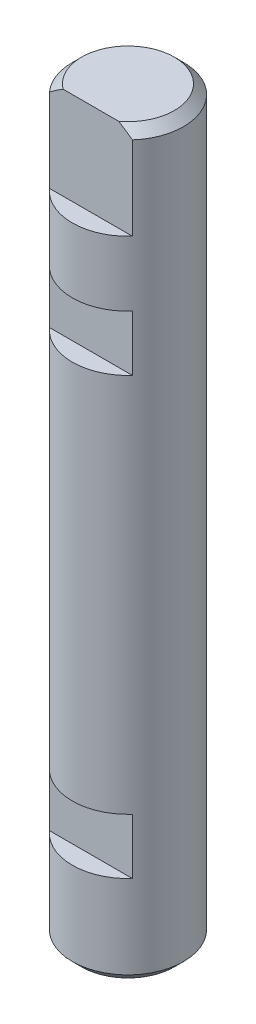
from build123d import *

# Parameters (mm, degrees)
CROQUIS1_R                 = 3
SALIENTE_EXTRUIR1_DEPTH    = 20
CORTAR_EXTRUIR2_DEPTH      = 41.224370722
CORTAR_EXTRUIR2_DEPTH_BACK = 5
CROQUIS3_W                 = 8.224241852
CROQUIS3_H                 = 1
CROQUIS8_W                 = 6
CROQUIS8_H                 = 3
CORTAR_EXTRUIR4_DEPTH      = 10
CHAFL_N1_SIZE              = 0.5


with BuildPart() as part:
    # Croquis1 → Saliente-Extruir1 (new, symmetric)
    with BuildSketch(Plane(origin=(0, 0, 0), x_dir=(1, 0, 0), z_dir=(0, 1, 0))):
        Circle(CROQUIS1_R)
    extrude(amount=SALIENTE_EXTRUIR1_DEPTH, both=True)

    # Croquis3 → Cortar-Extruir2 (cut, two sides: drawn at the far end of the back side and taken through both)
    with BuildSketch(Plane(origin=(0, 20, 0), x_dir=(1, 0, 0), z_dir=(0, 1, 0)).offset(-CORTAR_EXTRUIR2_DEPTH_BACK)):
        with Locations((0.237694851, -2.5)):
            Rectangle(CROQUIS3_W, CROQUIS3_H)
    extrude(amount=CORTAR_EXTRUIR2_DEPTH + CORTAR_EXTRUIR2_DEPTH_BACK, mode=Mode.SUBTRACT)

    # Croquis8 → Cortar-Extruir4 (cut)
    with BuildSketch(Plane.XY.offset(2)):
        with Locations((0, 10)):
            Rectangle(CROQUIS8_W, CROQUIS8_H)
        with Locations((0, -13.5)):
            Rectangle(CROQUIS8_W, CROQUIS8_H)
    extrude(amount=CORTAR_EXTRUIR4_DEPTH, mode=Mode.SUBTRACT)

    # Chaflán1
    chafl_n1_edges = [part.edges().sort_by_distance(p)[0] for p in [
        (-1.070466269, 20, -2.802517077),
        (-3, -20, 0),
    ]]
    chamfer(chafl_n1_edges, length=CHAFL_N1_SIZE)


solid = part.part
